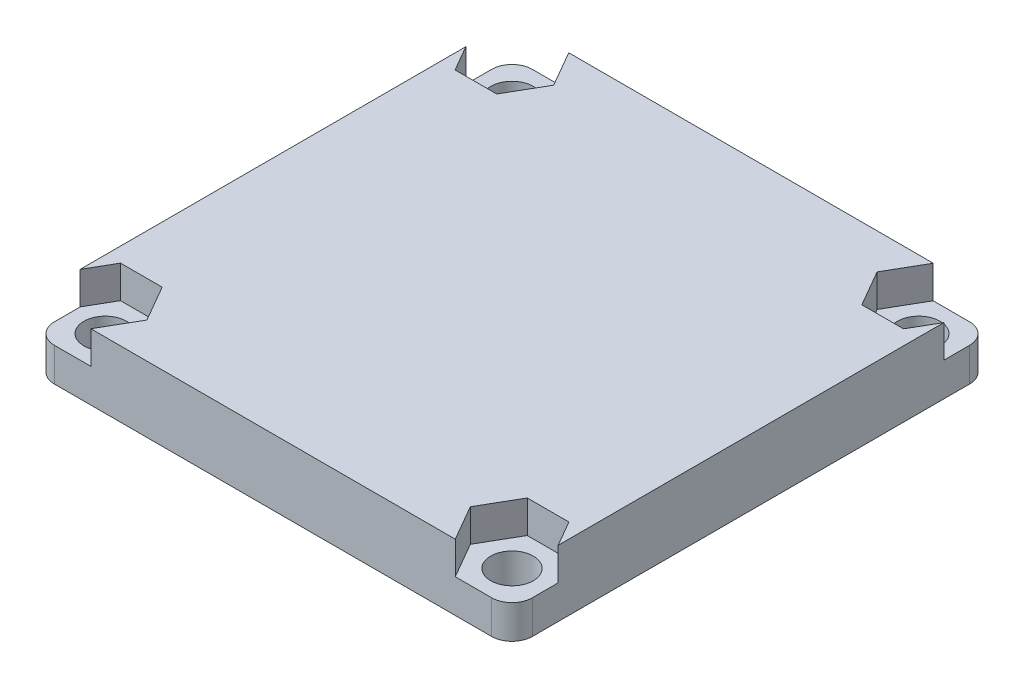
from build123d import *

# Parameters (mm, degrees)
SKETCH_1_W          = 47
SKETCH_1_H          = 47
EXTRUDE_1_DEPTH     = 6.5
SKETCH_2_R          = 2.1
CUT_EXTRUDE_1_DEPTH = 67.785103129
SKETCH_3_W          = 34.6
SKETCH_3_H          = 34.6
CUT_EXTRUDE_2_DEPTH = 2
FILLET_1_R          = 2
FILLET_2_R          = 1.5
FILLET_3_R          = 1.5
CUT_EXTRUDE_3_DEPTH = 3.2
SKETCH_5_W          = 3.789230485
SKETCH_5_H          = 3.5
CUT_EXTRUDE_4_DEPTH = 3.2


with BuildPart() as part:
    # Эскиз1 → Бобышка-Вытянуть1 (new body)
    with BuildSketch(Plane(origin=(0, 0, 0), x_dir=(1, 0, 0), z_dir=(0, 1, 0))):
        with Locations((-23.5, 23.5)):
            Rectangle(SKETCH_1_W, SKETCH_1_H)
    extrude(amount=EXTRUDE_1_DEPTH)

    # Эскиз2 → Вырез-Вытянуть1 (cut, through all)
    with BuildSketch(Plane.XZ):
        with Locations(Location((-43.5, -3.5, 0), (0, 0, 270))):
            Circle(SKETCH_2_R)
        with Locations(Location((-3.5, -3.5, 0), (0, 0, 270))):
            Circle(SKETCH_2_R)
        with Locations(Location((-3.5, -43.5, 0), (0, 0, 270))):
            Circle(SKETCH_2_R)
        with Locations(Location((-43.5, -43.5, 0), (0, 0, 270))):
            Circle(SKETCH_2_R)
    extrude(amount=-CUT_EXTRUDE_1_DEPTH, mode=Mode.SUBTRACT)

    # Эскиз3 → Вырез-Вытянуть2 (cut)
    with BuildSketch(Plane.XZ):
        with Locations((-23.5, -23.5)):
            Rectangle(SKETCH_3_W, SKETCH_3_H)
    extrude(amount=-CUT_EXTRUDE_2_DEPTH, mode=Mode.SUBTRACT)

    # Скругление1
    fillet_1_edges = [part.edges().sort_by_distance(p)[0] for p in [
        (0, 3.25, 0),
        (-47, 3.25, 0),
        (-47, 3.25, -47),
        (0, 3.25, -47),
    ]]
    fillet(fillet_1_edges, radius=FILLET_1_R)

    # Скругление2
    fillet_2_edges = [part.edges().sort_by_distance(p)[0] for p in [
        (-40.8, 2, -23.5),
        (-23.5, 2, -6.2),
        (-6.2, 2, -23.5),
        (-23.5, 2, -40.8),
    ]]
    fillet(fillet_2_edges, radius=FILLET_2_R)

    # Скругление3
    # the kernel refuses this fillet: 1.5 mm, written as the material it adds along each edge
    with BuildSketch(Plane(origin=(-39.3, 0.5, -39.3), x_dir=(0, 0, -1), z_dir=(-1, 0, 0))) as fillet_3_piece_1_section:
        Polygon((0, 0), (FILLET_3_R, 0), (FILLET_3_R, -FILLET_3_R), (0, -FILLET_3_R), align=None)
    fillet_3_piece_1 = extrude(amount=FILLET_3_R, mode=Mode.PRIVATE)
    fillet_3_piece_1 = fillet_3_piece_1 - Plane(origin=(-39.3, 0.5, -39.3), x_dir=(0, -0.7071067811865475, 0.7071067811865475), z_dir=(-1, 0, 0)) * Sphere(FILLET_3_R, mode=Mode.PRIVATE)
    add(fillet_3_piece_1)
    with BuildSketch(Plane(origin=(-39.3, 0.5, -7.7), x_dir=(0, 0, 1), z_dir=(-1, 0, 0))) as fillet_3_piece_2_section:
        Polygon((0, 0), (FILLET_3_R, 0), (FILLET_3_R, FILLET_3_R), (0, FILLET_3_R), align=None)
    fillet_3_piece_2 = extrude(amount=FILLET_3_R, mode=Mode.PRIVATE)
    fillet_3_piece_2 = fillet_3_piece_2 - Plane(origin=(-39.3, 0.5, -7.7), x_dir=(0, -0.7071067811865475, -0.7071067811865475), z_dir=(-1, 0, 0)) * Sphere(FILLET_3_R, mode=Mode.PRIVATE)
    add(fillet_3_piece_2)
    with BuildSketch(Plane(origin=(-7.7, 0.5, -39.3), x_dir=(1, 0, 0), z_dir=(0, 0, -1))) as fillet_3_piece_3_section:
        Polygon((0, 0), (FILLET_3_R, 0), (FILLET_3_R, -FILLET_3_R), (0, -FILLET_3_R), align=None)
    fillet_3_piece_3 = extrude(amount=FILLET_3_R, mode=Mode.PRIVATE)
    fillet_3_piece_3 = fillet_3_piece_3 - Plane(origin=(-7.7, 0.5, -39.3), x_dir=(-0.7071067811865475, -0.7071067811865475, 0), z_dir=(0, 0, -1)) * Sphere(FILLET_3_R, mode=Mode.PRIVATE)
    add(fillet_3_piece_3)
    with BuildSketch(Plane(origin=(-7.7, 0.5, -7.7), x_dir=(1, 0, 0), z_dir=(0, 0, 1))) as fillet_3_piece_4_section:
        Polygon((0, 0), (FILLET_3_R, 0), (FILLET_3_R, FILLET_3_R), (0, FILLET_3_R), align=None)
    fillet_3_piece_4 = extrude(amount=FILLET_3_R, mode=Mode.PRIVATE)
    fillet_3_piece_4 = fillet_3_piece_4 - Plane(origin=(-7.7, 0.5, -7.7), x_dir=(-0.7071067811865475, -0.7071067811865475, 0), z_dir=(0, 0, 1)) * Sphere(FILLET_3_R, mode=Mode.PRIVATE)
    add(fillet_3_piece_4)
    with BuildSketch(Plane(origin=(-6.2, 0, -6.2), x_dir=(-1, 0, 0), z_dir=(0, 1, 0)), Plane(origin=(-40.8, 0, -6.2), x_dir=(0, 0, -1), z_dir=(0, 1, 0))) as fillet_3_piece_5:
        with BuildLine():
            CenterArc((FILLET_3_R, -FILLET_3_R), FILLET_3_R, 90, 90)
            Line((0, -FILLET_3_R), (0, 0))
            Line((0, 0), (FILLET_3_R, 0))
        make_face()
    extrude(amount=0.5)
    with BuildSketch(Plane(origin=(-6.2, 0, -40.8), x_dir=(-1, 0, 0), z_dir=(0, 1, 0)), Plane(origin=(-40.8, 0, -40.8), x_dir=(0, 0, 1), z_dir=(0, 1, 0))) as fillet_3_piece_6:
        with BuildLine():
            CenterArc((FILLET_3_R, FILLET_3_R), FILLET_3_R, 180, 90)
            Line((0, FILLET_3_R), (0, 0))
            Line((0, 0), (FILLET_3_R, 0))
        make_face()
    extrude(amount=0.5)

    # Эскиз4 → Вырез-Вытянуть3 (cut)
    with BuildSketch(Plane(origin=(0, 6.5, 0), x_dir=(1, 0, 0), z_dir=(0, 1, 0))):
        Polygon((-5.549593456, 39.95), (-7.599186911, 43.5), (-5.549593456, 47.05), (-1.450406544, 47.05), (0.599186911, 43.5), (-1.450406544, 39.95), align=None)
        Polygon((-39.400813089, 43.5), (-41.450406544, 47.05), (-45.549593456, 47.05), (-47.599186911, 43.5), (-45.549593456, 39.95), (-41.450406544, 39.95), align=None)
        Polygon((-1.450406544, 7.05), (-5.549593456, 7.05), (-7.599186911, 3.5), (-5.549593456, -0.05), (-1.450406544, -0.05), (0.599186911, 3.5), align=None)
        Polygon((-41.450406544, 7.05), (-39.400813089, 3.5), (-41.450406544, -0.05), (-45.549593456, -0.05), (-47.599186911, 3.5), (-45.549593456, 7.05), align=None)
    extrude(amount=-CUT_EXTRUDE_3_DEPTH, mode=Mode.SUBTRACT)

    # Эскиз5 → Вырез-Вытянуть4 (cut)
    with BuildSketch(Plane(origin=(0, 6.5, 0), x_dir=(1, 0, 0), z_dir=(0, 1, 0))):
        with Locations((-45.105384758, 45.25)):
            Rectangle(SKETCH_5_W, SKETCH_5_H)
        with Locations((-1.894615243, 45.25)):
            Rectangle(SKETCH_5_W, SKETCH_5_H)
        with Locations((-45.105384758, 1.75)):
            Rectangle(SKETCH_5_W, SKETCH_5_H)
        with Locations((-1.894615243, 1.75)):
            Rectangle(SKETCH_5_W, SKETCH_5_H)
    extrude(amount=-CUT_EXTRUDE_4_DEPTH, mode=Mode.SUBTRACT)


solid = part.part
